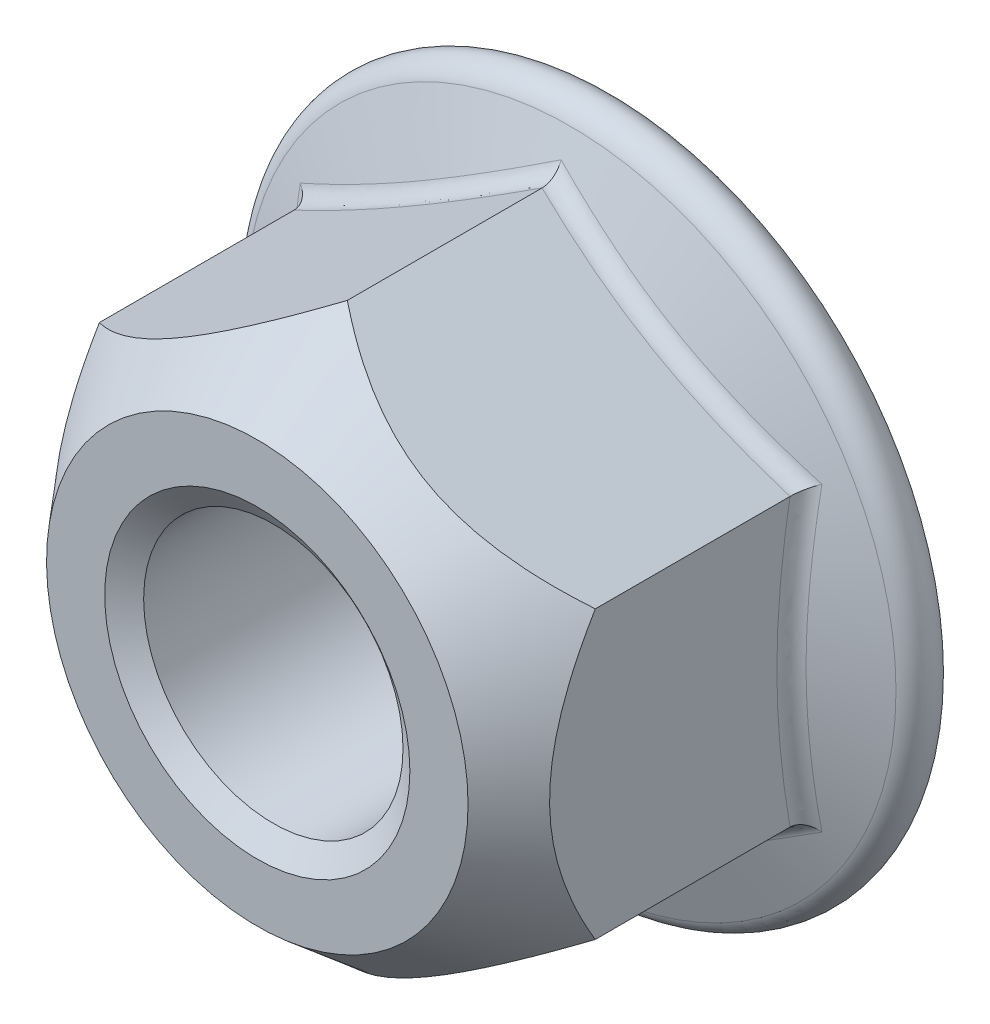
from build123d import *

# Parameters (mm, degrees)
THREADSCHEMATIC_START     = -9.4
THREADSCHEMATIC_OUTLINE_R = 3.4
THREADSCHEMATIC_DEPTH     = 9.4
FLANGEFILLET_R            = 0.48


# Read off the part's stored shape, not the designer's step: ThreadSchematic
with BuildPart() as part:
    # ThreadSchematic outline → ThreadSchematic (new body)
    with BuildSketch(Plane.XY.offset(THREADSCHEMATIC_START)):
        Polygon((6.5, 3.75277675), (0, 7.505553499), (-6.5, 3.75277675), (-6.5, -3.75277675), (0, -7.505553499), (6.5, -3.75277675), align=None)
        Circle(THREADSCHEMATIC_OUTLINE_R, mode=Mode.SUBTRACT)
    extrude(amount=THREADSCHEMATIC_DEPTH)

    # Sketch6 → Flange (revolve)
    with BuildSketch(Plane(origin=(0, 0, 0), x_dir=(0, 0, -1), z_dir=(1, 0, 0)), mode=Mode.PRIVATE) as flange_sk:
        with BuildLine():
            Line((6.328123777, 3.4), (8.2, 8.542937654))
            ThreePointArc((8.2, 8.542937654), (8.888773543, 8.940601245), (9.4, 8.331345278))
            Line((9.4, 8.331345278), (9.4, 3.4))
            Line((9.4, 3.4), (6.328123777, 3.4))
        make_face()
    revolve(flange_sk.sketch.rotate(Axis((0, 0, 0), (0, 0, -1)), 90), axis=Axis((0, 0, 0), (0, 0, -1)))

    # Sketch3 → Double-Chamfer (revolve, cut)
    with BuildSketch(Plane(origin=(0, 0, 0), x_dir=(0, 0, -1), z_dir=(1, 0, 0)), mode=Mode.PRIVATE) as double_chamfer_sk:
        Polygon((2.360331748, 20.205553499), (-12.7, 20.205553499), (-12.7, 5.525), (0, 5.525), (2.360331748, 7.505553499), align=None)
    revolve(double_chamfer_sk.sketch.rotate(Axis((0, 0, 0), (0, 0, -1)), 300.000000051), axis=Axis((0, 0, 0), (0, 0, -1)), mode=Mode.SUBTRACT)

    # FlangeFillet
    flangefillet_edges = [part.edges().sort_by_distance(p)[0] for p in [
        (6.5, 1.884573791, -7.553862438),
        (3.25, 5.629165124, -7.456431503),
        (-3.25, 5.629165124, -7.456431503),
        (-6.5, 0, -7.456431503),
        (-3.25, -5.629165124, -7.456431503),
        (3.25, -5.629165124, -7.456431503),
        (6.5, -1.884573791, -7.553862438),
    ]]
    fillet(flangefillet_edges, radius=FLANGEFILLET_R)

    # Sketch5 (on Right Plane) → EndChamfer (revolve, cut)
    with BuildSketch(Plane(origin=(0, 0, 0), x_dir=(0, 0, -1), z_dir=(1, 0, 0)), mode=Mode.PRIVATE) as endchamfer_sk:
        Polygon((9.3746, 4), (8.912463025, 3.34), (9.4254, 3.34), (9.4254, 4), align=None)
        Polygon((-0.0508, 4), (0, 4), (0.462136975, 3.34), (-0.0508, 3.34), align=None)
    revolve(endchamfer_sk.sketch.rotate(Axis((0, 0, -25.037505729), (0, 0, -1)), 90), axis=Axis((0, 0, -25.037505729), (0, 0, -1)), mode=Mode.SUBTRACT)


solid = part.part
